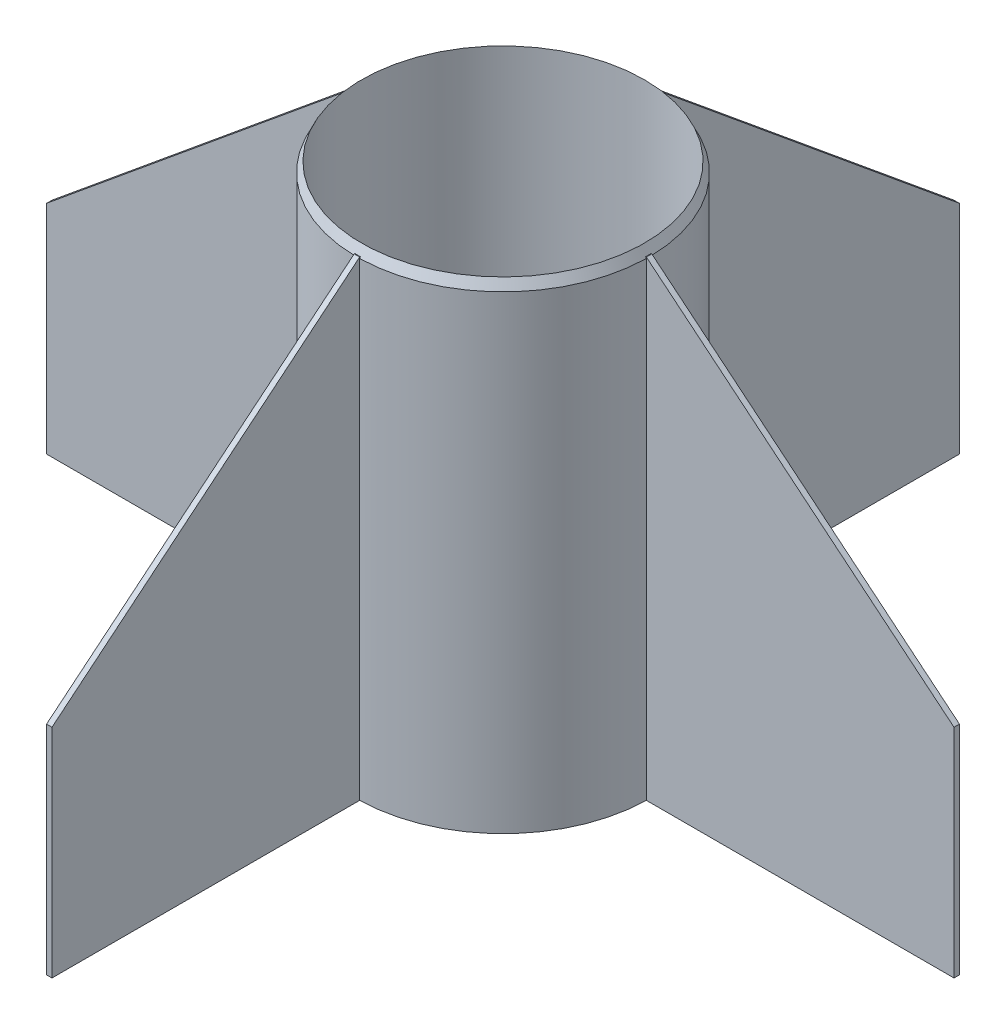
from build123d import *

# Parameters (mm, degrees)
SKETCH1_R                = 80.7
SKETCH1_R_2              = 78.2
BOSS_EXTRUDE1_DEPTH      = 260
BOSS_EXTRUDE2_DEPTH      = 1.5
BOSS_EXTRUDE2_DEPTH_BACK = 1.5
BOSS_EXTRUDE3_DEPTH      = 1.5
BOSS_EXTRUDE3_DEPTH_BACK = 1.5
SKETCH4_W                = 2
SKETCH4_H                = 260
CIRPATTERN1_COUNT        = 4
SKETCH6_R                = 78.2
BOSS_EXTRUDE4_DEPTH      = 10
CHAMFER1_START           = 264.638732699
CHAMFER1_2_OUTLINE_R     = 80.7
CHAMFER1_2_OUTLINE_R_2   = 78.2
CHAMFER1_2_DEPTH         = 5.361267301
CHAMFER1_START_2         = 258
CHAMFER1_3_DEPTH         = 2


with BuildPart() as part:
    # Sketch1 → Boss-Extrude1 (new body)
    with BuildSketch(Plane(origin=(0, 0, 0), x_dir=(1, 0, 0), z_dir=(0, 1, 0))):
        with Locations(Location((0, 0, 0), (0, 0, 270))):
            Circle(SKETCH1_R)
        with Locations(Location((0, 0, 0), (0, 0, 270))):
            Circle(SKETCH1_R_2, mode=Mode.SUBTRACT)
    extrude(amount=BOSS_EXTRUDE1_DEPTH)



with BuildPart() as body_2:
    # Sketch2 → Boss-Extrude2 (new, two sides: drawn at the far end of the back side and taken through both)
    with BuildSketch(Plane.XY.offset(-BOSS_EXTRUDE2_DEPTH_BACK)):
        Polygon((80.7, 0), (80.7, 260), (250.7, 120), (250.7, 0), align=None)
    extrude(amount=BOSS_EXTRUDE2_DEPTH + BOSS_EXTRUDE2_DEPTH_BACK)


with BuildPart() as part_1:
    add(part.part)

    add(body_2.part)  # Boss-Extrude3 merges body 2
    # Sketch4 → Boss-Extrude3 (add, two sides: drawn at the far end of the back side and taken through both)
    with BuildSketch(Plane.XY.offset(-BOSS_EXTRUDE3_DEPTH_BACK)):
        with Locations((79.7, 130)):
            Rectangle(SKETCH4_W, SKETCH4_H)
    extrude(amount=BOSS_EXTRUDE3_DEPTH + BOSS_EXTRUDE3_DEPTH_BACK)


with BuildPart() as cirpattern1_1:
    # CirPattern1: pattern copy
    add(part_1.part.rotate(Axis((0, 0, 0), (0, 1, 0)), 1 * 360 / CIRPATTERN1_COUNT))


with BuildPart() as cirpattern1_2:
    # CirPattern1: pattern copy
    add(part_1.part.rotate(Axis((0, 0, 0), (0, 1, 0)), 2 * 360 / CIRPATTERN1_COUNT))


with BuildPart() as cirpattern1_3:
    # CirPattern1: pattern copy
    add(part_1.part.rotate(Axis((0, 0, 0), (0, 1, 0)), 3 * 360 / CIRPATTERN1_COUNT))


with BuildPart() as part_2:
    add(part_1.part)

    add(cirpattern1_1.part)  # Boss-Extrude4 merges CirPattern1_1

    add(cirpattern1_2.part)  # Boss-Extrude4 merges CirPattern1_2

    add(cirpattern1_3.part)  # Boss-Extrude4 merges CirPattern1_3
    # Sketch6 → Boss-Extrude4 (add)
    with BuildSketch(Plane(origin=(0, 260, 0), x_dir=(1, 0, 0), z_dir=(0, 1, 0))):
        with BuildLine():
            ThreePointArc((80.686058275, -1.5), (80.7, 0), (80.686058275, 1.5))
            ThreePointArc((80.686058275, 1.5), (57.063517242, 57.063517242), (1.5, 80.686058275))
            ThreePointArc((1.5, 80.686058275), (0, 80.7), (-1.5, 80.686058275))
            ThreePointArc((-1.5, 80.686058275), (-57.063517242, -57.063517242), (80.686058275, -1.5))
        make_face()
        with Locations(Location((0, 0, 0), (0, 0, 270))):
            Circle(SKETCH6_R, mode=Mode.SUBTRACT)
    extrude(amount=BOSS_EXTRUDE4_DEPTH)

    # Chamfer1: read off the stored shape, not the designer's step
    # Chamfer1 outline → Chamfer1 (revolve, cut)
    with BuildSketch(Plane.XY):
        Polygon((78.2, 264.638732699), (80.7, 259.277465397), (80.7, 264.638732699), align=None)
    revolve(axis=Axis((0, 0, 0), (0, 1, 0)), mode=Mode.SUBTRACT)

    # Chamfer1 2 outline → Chamfer1 2 (cut)
    with BuildSketch(Plane(origin=(0, 0, 0), x_dir=(1, 0, 0), z_dir=(0, 1, 0)).offset(CHAMFER1_START)):
        Circle(CHAMFER1_2_OUTLINE_R)
        Circle(CHAMFER1_2_OUTLINE_R_2, mode=Mode.SUBTRACT)
    extrude(amount=CHAMFER1_2_DEPTH, mode=Mode.SUBTRACT)

    # Chamfer1 3 outline → Chamfer1 3 (add)
    with BuildSketch(Plane(origin=(0, 0, 0), x_dir=(1, 0, 0), z_dir=(0, 1, 0)).offset(CHAMFER1_START_2)):
        with BuildLine():
            ThreePointArc((80.686058275, -1.5), (80.7, 0), (80.686058275, 1.5))
            Line((80.686058275, 1.5), (80.349076396, 1.5))
            ThreePointArc((80.349076396, 1.5), (80.363076582, 0), (80.349076396, -1.5))
            Line((80.349076396, -1.5), (80.686058275, -1.5))
        make_face()
        with BuildLine():
            Line((1.5, 80.349076396), (1.5, 80.686058275))
            ThreePointArc((1.5, 80.686058275), (0, 80.7), (-1.5, 80.686058275))
            Line((-1.5, 80.686058275), (-1.5, 80.349076396))
            ThreePointArc((-1.5, 80.349076396), (0, 80.363076582), (1.5, 80.349076396))
        make_face()
        with BuildLine():
            ThreePointArc((-1.5, -80.686058275), (0, -80.7), (1.5, -80.686058275))
            Line((1.5, -80.686058275), (1.5, -80.349076396))
            ThreePointArc((1.5, -80.349076396), (0, -80.363076582), (-1.5, -80.349076396))
            Line((-1.5, -80.349076396), (-1.5, -80.686058275))
        make_face()
        with BuildLine():
            Line((-80.349076396, 1.5), (-80.686058275, 1.5))
            ThreePointArc((-80.686058275, 1.5), (-80.7, 0), (-80.686058275, -1.5))
            Line((-80.686058275, -1.5), (-80.349076396, -1.5))
            ThreePointArc((-80.349076396, -1.5), (-80.363076582, 0), (-80.349076396, 1.5))
        make_face()
    extrude(amount=CHAMFER1_3_DEPTH)


solid = part_2.part
